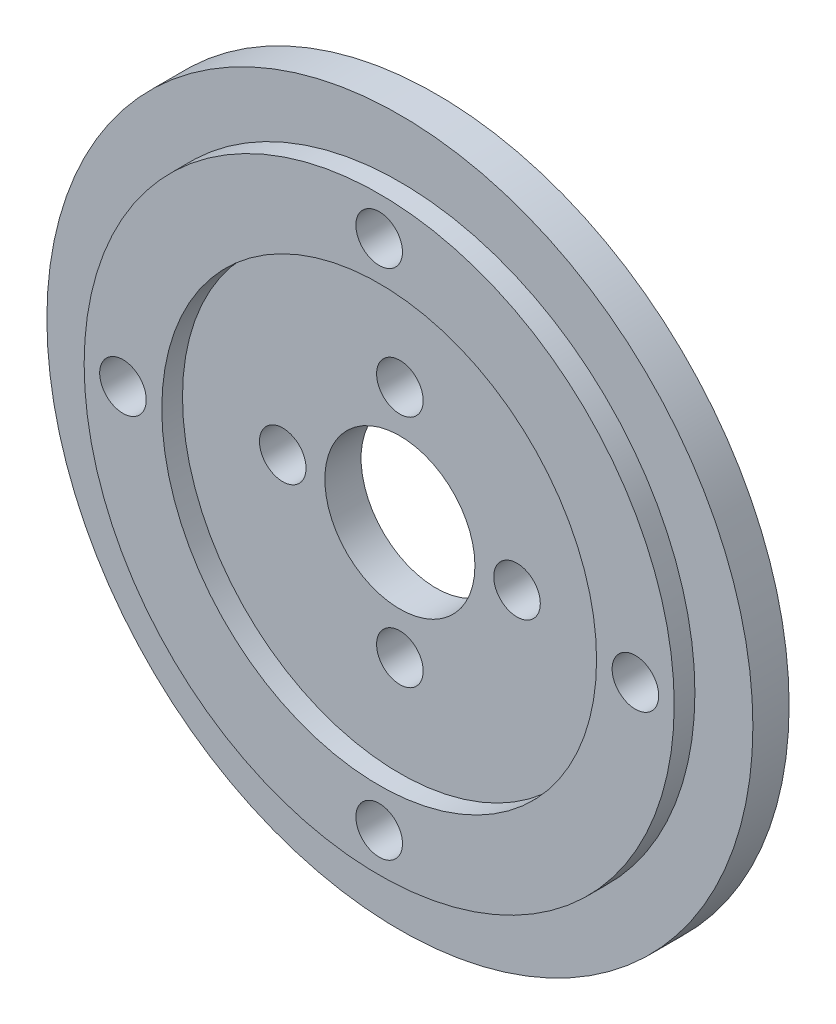
from build123d import *

# Parameters (mm, degrees)
SKETCH1_R               = 34.1
BOSS_EXTRUDE1_DEPTH     = 1.75
SKETCH4_R               = 28.5
SKETCH4_R_2             = 21
BOSS_EXTRUDE2_DEPTH     = 2
CUT_EXTRUDE2_DEPTH      = 49.351525312
CUT_EXTRUDE2_DEPTH_BACK = 49.351525312
SKETCH3_R               = 2.25
SKETCH2_R               = 7.25
CUT_EXTRUDE1_DEPTH      = 49.351525312


with BuildPart() as part:
    # Sketch1 → Boss-Extrude1 (new, symmetric)
    with BuildSketch(Plane.XY):
        Circle(SKETCH1_R)
    extrude(amount=BOSS_EXTRUDE1_DEPTH, both=True)

    # Sketch4 → Boss-Extrude2 (add)
    with BuildSketch(Plane.XY.offset(1.75)):
        Circle(SKETCH4_R)
        Circle(SKETCH4_R_2, mode=Mode.SUBTRACT)
    extrude(amount=BOSS_EXTRUDE2_DEPTH)

    # Sketch3 → Cut-Extrude2 (cut, two sides: drawn at the far end of the back side and taken through both)
    with BuildSketch(Plane.XY.offset(1.75).offset(-CUT_EXTRUDE2_DEPTH_BACK)):
        with Locations((0, 24.75)):
            Circle(SKETCH3_R)
        with Locations((0, 11.3137085)):
            Circle(SKETCH3_R)
        with Locations((24.75, 0)):
            Circle(SKETCH3_R)
        with Locations((11.3137085, 0)):
            Circle(SKETCH3_R)
        with Locations((0, -24.75)):
            Circle(SKETCH3_R)
        with Locations((0, -11.3137085)):
            Circle(SKETCH3_R)
        with Locations((-24.75, 0)):
            Circle(SKETCH3_R)
        with Locations((-11.3137085, 0)):
            Circle(SKETCH3_R)
    extrude(amount=CUT_EXTRUDE2_DEPTH + CUT_EXTRUDE2_DEPTH_BACK, mode=Mode.SUBTRACT)

    # Sketch2 → Cut-Extrude1 (cut, through all)
    with BuildSketch(Plane.XY.offset(1.75)):
        Circle(SKETCH2_R)
    extrude(amount=-CUT_EXTRUDE1_DEPTH, mode=Mode.SUBTRACT)


solid = part.part
